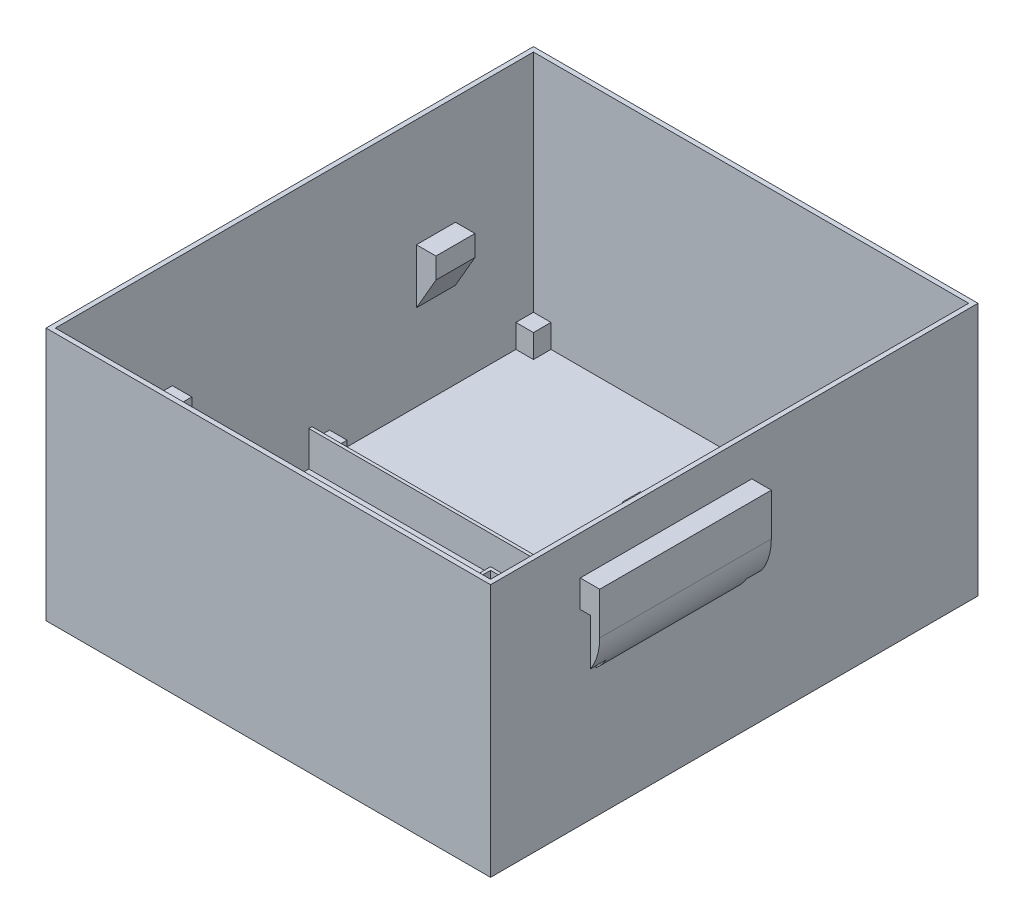
from build123d import *

# Parameters (mm, degrees)
SKETCH1_W                  = 114
SKETCH1_H                  = 125
BOSS_EXTRUDE1_DEPTH        = 65
SKETCH2_W                  = 111.6
SKETCH2_H                  = 122.6
CUT_EXTRUDE1_DEPTH         = 63.8
SKETCH3_W                  = 44
SKETCH3_H                  = 22
BOSS_EXTRUDE2_DEPTH        = 5
SKETCH4_W                  = 2.65
SKETCH4_H                  = 15
CUT_EXTRUDE2_DEPTH         = 4
SKETCH6_W                  = 2.65
SKETCH6_H                  = 15
CUT_EXTRUDE3_DEPTH         = 4
FILLET1_R                  = 15
FILLET2_R                  = 15
SKETCH9_W                  = 111.6
SKETCH9_H                  = 57.6
SKETCH9_W_2                = 48.6
SKETCH9_H_2                = 48.6
SKETCH9_W_3                = 53.6
SKETCH9_H_3                = 53.6
BOSS_EXTRUDE4_DEPTH        = 9
SKETCH10_W                 = 111.6
SKETCH10_H                 = 56.8
SKETCH10_W_2               = 47
SKETCH10_H_2               = 47
SKETCH10_W_3               = 52
SKETCH10_H_3               = 52
CUT_EXTRUDE5_DEPTH         = 9
SKETCH11_W                 = 4.5
SKETCH11_H                 = 4.5
SKETCH11_H_2               = 56.8
BOSS_EXTRUDE5_DEPTH        = 6
SKETCH12_W                 = 10
SKETCH12_H                 = 5
BOSS_EXTRUDE6_DEPTH        = 5
CHAMFER1_SIZE              = 9
CHAMFER1_SIZE_2            = 5.196152423
CHAMFER1_OF_MIRROR8_SIZE   = 9
CHAMFER1_OF_MIRROR8_SIZE_2 = 5.196152423


with BuildPart() as part:
    # Sketch1 → Boss-Extrude1 (new body)
    with BuildSketch(Plane(origin=(0, 0, 0), x_dir=(1, 0, 0), z_dir=(0, 1, 0))):
        Rectangle(SKETCH1_W, SKETCH1_H)
    extrude(amount=BOSS_EXTRUDE1_DEPTH)

    # Sketch2 → Cut-Extrude1 (cut)
    with BuildSketch(Plane(origin=(0, 65, 0), x_dir=(1, 0, 0), z_dir=(0, 1, 0))):
        Rectangle(SKETCH2_W, SKETCH2_H)
    extrude(amount=-CUT_EXTRUDE1_DEPTH, mode=Mode.SUBTRACT)

    # Sketch3 → Boss-Extrude2 (add)
    with BuildSketch(Plane(origin=(57, 0, 0), x_dir=(0, 0, -1), z_dir=(1, 0, 0))):
        with Locations((-17.5, 44)):
            Rectangle(SKETCH3_W, SKETCH3_H)
    boss_extrude2 = extrude(amount=BOSS_EXTRUDE2_DEPTH)

    # Sketch4 → Cut-Extrude2 (cut)
    with BuildSketch(Plane.XY.offset(39.5)):
        with Locations((58.325, 40.5)):
            Rectangle(SKETCH4_W, SKETCH4_H)
    cut_extrude2 = extrude(amount=-CUT_EXTRUDE2_DEPTH, mode=Mode.SUBTRACT)

    # Sketch6 → Cut-Extrude3 (cut)
    with BuildSketch(Plane(origin=(0, 0, -4.5), x_dir=(-1, 0, 0), z_dir=(0, 0, -1))):
        with Locations((-58.325, 40.5)):
            Rectangle(SKETCH6_W, SKETCH6_H)
    cut_extrude3 = extrude(amount=-CUT_EXTRUDE3_DEPTH, mode=Mode.SUBTRACT)

    # Mirror5: Boss-Extrude2 across plane
    add(boss_extrude2.mirror(Plane(origin=(0, 0, 0), x_dir=(0, 0, 1), z_dir=(1, 0, 0))))

    # Mirror6: Cut-Extrude2 across plane
    add(cut_extrude2.mirror(Plane(origin=(0, 0, 0), x_dir=(0, 0, 1), z_dir=(1, 0, 0))), mode=Mode.SUBTRACT)

    # Mirror7: Cut-Extrude3 across plane
    add(cut_extrude3.mirror(Plane(origin=(0, 0, 0), x_dir=(0, 0, 1), z_dir=(1, 0, 0))), mode=Mode.SUBTRACT)

    # Fillet1
    # the kernel refuses this fillet: 15 mm, written as the material it takes off along each edge
    with BuildSketch(Plane(origin=(62, 33, -32.450849719), x_dir=(-1, 0, 0), z_dir=(0, 0, 1))) as fillet1_piece_1:
        with BuildLine():
            CenterArc((15, -11.180339887), FILLET1_R, 131.810314896, 48.189685104)
            Line((0, -11.180339887), (-0.3, -11.180339887))
            Line((-0.3, -11.180339887), (-0.3, 0))
            Line((-0.3, 0), (0, 0.3))
            ThreePointArc((0, 0.3), (2.5, 0.3), (4.8, 0.223606798))
            Line((4.8, 0.223606798), (5, 0))
        make_face()
    extrude(amount=99.901699437, mode=Mode.SUBTRACT)

    # Fillet2
    # the kernel refuses this fillet: 15 mm, written as the material it takes off along each edge
    with BuildSketch(Plane(origin=(-62, 33, -32.450849719), x_dir=(1, 0, 0), z_dir=(0, 0, 1))) as fillet2_piece_1:
        with BuildLine():
            CenterArc((15, 11.180339887), FILLET2_R, 180, 48.189685104)
            Line((0, 11.180339887), (-0.3, 11.180339887))
            Line((-0.3, 11.180339887), (-0.3, 0))
            Line((-0.3, 0), (0, -0.3))
            ThreePointArc((0, -0.3), (2.5, -0.3), (4.8, -0.223606798))
            Line((4.8, -0.223606798), (5, 0))
        make_face()
    extrude(amount=99.901699437, mode=Mode.SUBTRACT)

    # Sketch9 → Boss-Extrude4 (add)
    with BuildSketch(Plane(origin=(0, 1.2, 0), x_dir=(1, 0, 0), z_dir=(0, 1, 0))):
        with Locations((0, 32.5)):
            Rectangle(SKETCH9_W, SKETCH9_H)
        with Locations((-27.5, -33)):
            Rectangle(SKETCH9_W_2, SKETCH9_H_2)
        with Locations((25, -30.5)):
            Rectangle(SKETCH9_W_3, SKETCH9_H_3)
    extrude(amount=BOSS_EXTRUDE4_DEPTH)

    # Sketch10 → Cut-Extrude5 (cut)
    with BuildSketch(Plane(origin=(0, 10.2, 0), x_dir=(1, 0, 0), z_dir=(0, 1, 0))):
        with Locations((0, 32.9)):
            Rectangle(SKETCH10_W, SKETCH10_H)
        with Locations((-27.5, -33)):
            Rectangle(SKETCH10_W_2, SKETCH10_H_2)
        with Locations((25, -30.5)):
            Rectangle(SKETCH10_W_3, SKETCH10_H_3)
    extrude(amount=-CUT_EXTRUDE5_DEPTH, mode=Mode.SUBTRACT)

    # Sketch11 → Boss-Extrude5 (add)
    with BuildSketch(Plane(origin=(0, 1.2, 0), x_dir=(1, 0, 0), z_dir=(0, 1, 0))):
        with Locations((-53.55, 59.05)):
            Rectangle(SKETCH11_W, SKETCH11_H)
        with Locations((-53.55, 6.75)):
            Rectangle(SKETCH11_W, SKETCH11_H)
        with Locations((53.55, 32.9)):
            Rectangle(SKETCH11_W, SKETCH11_H_2)
        with Locations((-48.75, -11.75)):
            Rectangle(SKETCH11_W, SKETCH11_H)
        with Locations((1.25, -6.75)):
            Rectangle(SKETCH11_W, SKETCH11_H)
        with Locations((-6.25, -11.75)):
            Rectangle(SKETCH11_W, SKETCH11_H)
        with Locations((48.75, -6.75)):
            Rectangle(SKETCH11_W, SKETCH11_H)
        with Locations((-48.75, -54.25)):
            Rectangle(SKETCH11_W, SKETCH11_H)
        with Locations((1.25, -54.25)):
            Rectangle(SKETCH11_W, SKETCH11_H)
        with Locations((-6.25, -54.25)):
            Rectangle(SKETCH11_W, SKETCH11_H)
        with Locations((48.75, -54.25)):
            Rectangle(SKETCH11_W, SKETCH11_H)
        with Locations((0, 32.9)):
            Rectangle(SKETCH11_W, SKETCH11_H)
    extrude(amount=BOSS_EXTRUDE5_DEPTH)

    # Sketch12 → Boss-Extrude6 (add)
    with BuildSketch(Plane.ZY.offset(-55.8)):
        with Locations((-36.3, 34.7)):
            Rectangle(SKETCH12_W, SKETCH12_H)
        with Locations((36.3, 34.7)):
            Rectangle(SKETCH12_W, SKETCH12_H)
    boss_extrude6 = extrude(amount=BOSS_EXTRUDE6_DEPTH)

    # Chamfer1
    # the kernel refuses this chamfer: 9, 5.196152423 mm, written as the material it adds along each edge
    with BuildSketch(Plane(origin=(55.8, 32.2, 41.3), x_dir=(0.019326765612700678, -0.999813220622208, 0), z_dir=(0, 0, -1))) as chamfer1_piece_1_section:
        Polygon((CHAMFER1_SIZE * 0.999813220622, CHAMFER1_SIZE * 0.0193267656127), (-CHAMFER1_SIZE_2 * 0.0193267656116, CHAMFER1_SIZE_2 * 0.999813220566), (0, 0), align=None)
    chamfer1_piece_1 = extrude(amount=10, mode=Mode.PRIVATE)
    chamfer1_piece_1 = split(chamfer1_piece_1, bisect_by=Plane(origin=(50.8, 29.159896695, 36.3), z_dir=(1, 0, 0)), keep=Keep.TOP, mode=Mode.PRIVATE)
    add(chamfer1_piece_1)
    with BuildSketch(Plane(origin=(55.8, 32.2, -31.3), x_dir=(0.019326765612700678, -0.999813220622208, 0), z_dir=(0, 0, -1))) as chamfer1_piece_2_section:
        Polygon((CHAMFER1_SIZE * 0.999813220622, CHAMFER1_SIZE * 0.0193267656127), (-CHAMFER1_SIZE_2 * 0.0193267656116, CHAMFER1_SIZE_2 * 0.999813220566), (0, 0), align=None)
    chamfer1_piece_2 = extrude(amount=10, mode=Mode.PRIVATE)
    chamfer1_piece_2 = split(chamfer1_piece_2, bisect_by=Plane(origin=(50.8, 29.159896695, -36.3), z_dir=(1, 0, 0)), keep=Keep.TOP, mode=Mode.PRIVATE)
    add(chamfer1_piece_2)

    # Mirror8: Boss-Extrude6 across plane
    add(boss_extrude6.mirror(Plane(origin=(0, 0, 0), x_dir=(0, 0, 1), z_dir=(1, 0, 0))))

    # Chamfer1 of Mirror8
    # the kernel refuses this chamfer: 9, 5.196152423 mm, written as the material it adds along each edge
    with BuildSketch(Plane(origin=(-55.8, 32.2, 41.3), x_dir=(-0.01932676561270296, -0.9998132206222078, 0), z_dir=(0, 0, -1))) as chamfer1_of_mirror8_piece_1_section:
        Polygon((CHAMFER1_OF_MIRROR8_SIZE * 0.999813220622, -CHAMFER1_OF_MIRROR8_SIZE * 0.0193267656127), (-CHAMFER1_OF_MIRROR8_SIZE_2 * 0.0193267656116, -CHAMFER1_OF_MIRROR8_SIZE_2 * 0.999813220566), (0, 0), align=None)
    chamfer1_of_mirror8_piece_1 = extrude(amount=10, mode=Mode.PRIVATE)
    chamfer1_of_mirror8_piece_1 = split(chamfer1_of_mirror8_piece_1, bisect_by=Plane(origin=(-50.8, 29.159896695, 36.3), z_dir=(-1, 0, 0)), keep=Keep.TOP, mode=Mode.PRIVATE)
    add(chamfer1_of_mirror8_piece_1)
    with BuildSketch(Plane(origin=(-55.8, 32.2, -31.3), x_dir=(-0.01932676561270296, -0.9998132206222078, 0), z_dir=(0, 0, -1))) as chamfer1_of_mirror8_piece_2_section:
        Polygon((CHAMFER1_OF_MIRROR8_SIZE * 0.999813220622, -CHAMFER1_OF_MIRROR8_SIZE * 0.0193267656127), (-CHAMFER1_OF_MIRROR8_SIZE_2 * 0.0193267656116, -CHAMFER1_OF_MIRROR8_SIZE_2 * 0.999813220566), (0, 0), align=None)
    chamfer1_of_mirror8_piece_2 = extrude(amount=10, mode=Mode.PRIVATE)
    chamfer1_of_mirror8_piece_2 = split(chamfer1_of_mirror8_piece_2, bisect_by=Plane(origin=(-50.8, 29.159896695, -36.3), z_dir=(-1, 0, 0)), keep=Keep.TOP, mode=Mode.PRIVATE)
    add(chamfer1_of_mirror8_piece_2)


solid = part.part
